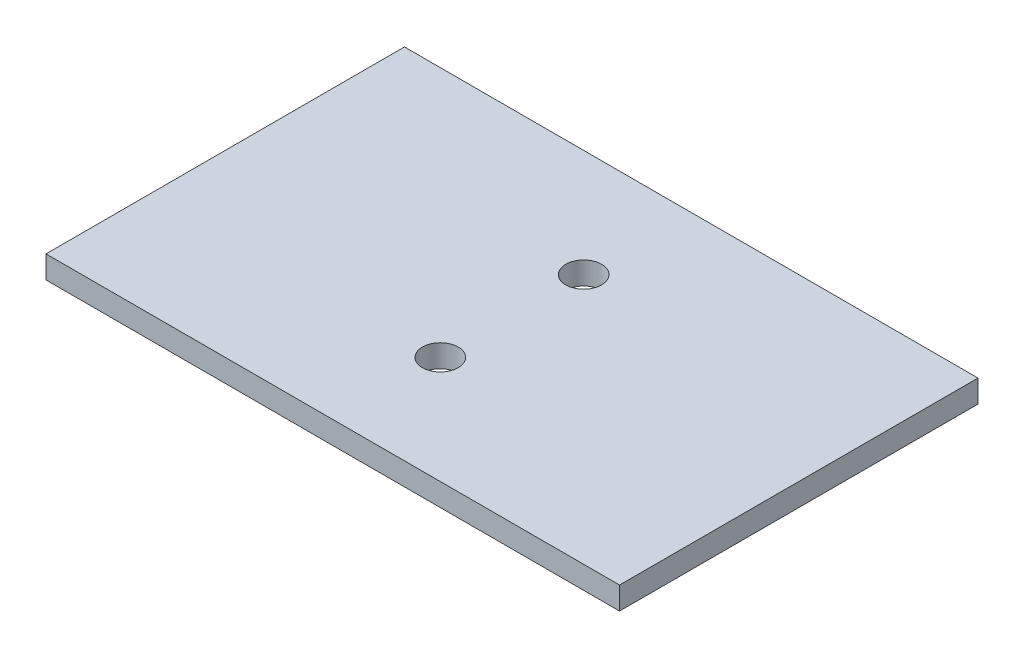
from build123d import *

# Parameters (mm, degrees)
SKETCH1_W           = 50.8
SKETCH1_H           = 31.75
SKETCH1_R           = 1.5875
BOSS_EXTRUDE1_DEPTH = 2


with BuildPart() as part:
    # Sketch1 → Boss-Extrude1 (new body)
    with BuildSketch(Plane(origin=(0, 0, 0), x_dir=(1, 0, 0), z_dir=(0, 1, 0))):
        Rectangle(SKETCH1_W, SKETCH1_H)
        with Locations((0, 6.35)):
            Circle(SKETCH1_R, mode=Mode.SUBTRACT)
        with Locations((0, -6.35)):
            Circle(SKETCH1_R, mode=Mode.SUBTRACT)
    extrude(amount=BOSS_EXTRUDE1_DEPTH)


solid = part.part
